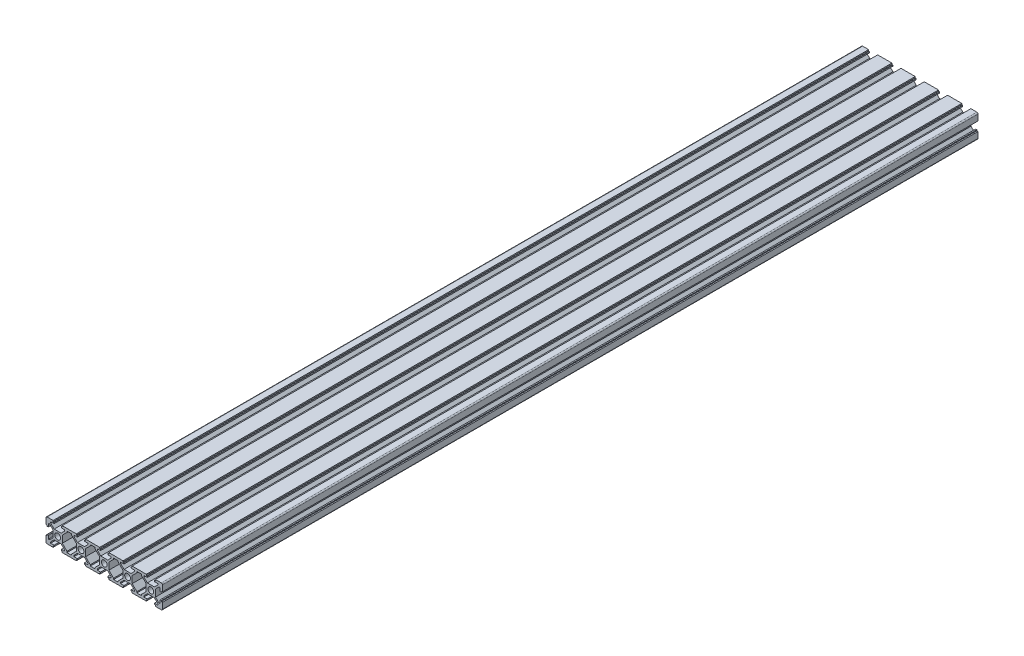
from build123d import *

# Parameters (mm, degrees)
SKETCH1_R              = 2.5
EXTRUDE1_DEPTH         = 350
FILLET_2_R             = 1
CUT_EXTRUDE1_START     = -4
CUT_EXTRUDE1_OUTLINE_R = 2
CUT_EXTRUDE1_DEPTH     = 8


# Read off the part's stored shape, not the designer's step: Cut-Extrude1
with BuildPart() as part:
    # Sketch1 → Extrude1 (new, symmetric)
    with BuildSketch(Plane.XY):
        Polygon((-20, 10), (-13.9, 10), (-13.9, 8.996845012), (-13.1, 8.996845012), (-13.1, 8), (-16.004631122, 8), (-16.004631122, 6.994580616), (-13.010050506, 4), (-6.989949494, 4), (-3.995368878, 6.994580616), (-3.995368878, 8), (-6.9, 8), (-6.9, 8.996845012), (-6.1, 8.996845012), (-6.1, 10), (6.1, 10), (6.1, 8.996845012), (6.9, 8.996845012), (6.9, 8), (3.995368878, 8), (3.995368878, 6.994580616), (6.989949494, 4), (13.010050506, 4), (16.004631122, 6.994580616), (16.004631122, 8), (13.1, 8), (13.1, 8.996845012), (13.9, 8.996845012), (13.9, 10), (26.1, 10), (26.1, 8.996845012), (26.9, 8.996845012), (26.9, 8), (23.995368878, 8), (23.995368878, 6.994580616), (26.989949494, 4), (33.010050506, 4), (36.004631122, 6.994580616), (36.004631122, 8), (33.1, 8), (33.1, 8.996845012), (33.9, 8.996845012), (33.9, 10), (46.1, 10), (46.1, 8.996845012), (46.9, 8.996845012), (46.9, 8), (43.995368878, 8), (43.995368878, 6.994580616), (46.989949494, 4), (53.010050506, 4), (56.004631122, 6.994580616), (56.004631122, 8), (53.1, 8), (53.1, 8.996845012), (53.9, 8.996845012), (53.9, 10), (66.1, 10), (66.1, 8.996845012), (66.9, 8.996845012), (66.9, 8), (63.995368878, 8), (63.995368878, 6.994580616), (66.989949494, 4), (73.010050506, 4), (76.004631122, 6.994580616), (76.004631122, 8), (73.1, 8), (73.1, 8.996845012), (73.9, 8.996845012), (73.9, 10), (80, 10), (80, 3.9), (78.996845012, 3.9), (78.996845012, 3.09747601), (78, 3.09747601), (78, 6), (76.989949494, 6), (74, 3.010050506), (74, -3.010050506), (76.989949494, -6), (78, -6), (78, -3.09747601), (78.996845012, -3.09747601), (78.996845012, -3.9), (80, -3.9), (80, -10), (73.9, -10), (73.9, -8.996845012), (73.1, -8.996845012), (73.1, -8), (76.004631122, -8), (76.004631122, -6.994580616), (73.010050506, -4), (66.989949494, -4), (63.995368878, -6.994580616), (63.995368878, -8), (66.9, -8), (66.9, -8.996845012), (66.1, -8.996845012), (66.1, -10), (53.9, -10), (53.9, -8.996845012), (53.1, -8.996845012), (53.1, -8), (56.004631122, -8), (56.004631122, -6.994580616), (53.010050506, -4), (46.989949494, -4), (43.995368878, -6.994580616), (43.995368878, -8), (46.9, -8), (46.9, -8.996845012), (46.1, -8.996845012), (46.1, -10), (33.9, -10), (33.9, -8.996845012), (33.1, -8.996845012), (33.1, -8), (36.004631122, -8), (36.004631122, -6.994580616), (33.010050506, -4), (26.989949494, -4), (23.995368878, -6.994580616), (23.995368878, -8), (26.9, -8), (26.9, -8.996845012), (26.1, -8.996845012), (26.1, -10), (13.9, -10), (13.9, -8.996845012), (13.1, -8.996845012), (13.1, -8), (16.004631122, -8), (16.004631122, -6.994580616), (13.010050506, -4), (6.989949494, -4), (3.995368878, -6.994580616), (3.995368878, -8), (6.9, -8), (6.9, -8.996845012), (6.1, -8.996845012), (6.1, -10), (-6.1, -10), (-6.1, -8.996845012), (-6.9, -8.996845012), (-6.9, -8), (-3.995368878, -8), (-3.995368878, -6.994580616), (-6.989949494, -4), (-13.010050506, -4), (-16.004631122, -6.994580616), (-16.004631122, -8), (-13.1, -8), (-13.1, -8.996845012), (-13.9, -8.996845012), (-13.9, -10), (-20, -10), (-20, -3.9), (-18.996845012, -3.9), (-18.996845012, -3.09747601), (-18, -3.09747601), (-18, -6), (-16.989949494, -6), (-14, -3.010050506), (-14, 3.010050506), (-16.989949494, 6), (-18, 6), (-18, 3.09747601), (-18.996845012, 3.09747601), (-18.996845012, 3.9), (-20, 3.9), align=None)
        with Locations((-10, 0)):
            Circle(SKETCH1_R, mode=Mode.SUBTRACT)
        with Locations((10, 0)):
            Circle(SKETCH1_R, mode=Mode.SUBTRACT)
        with Locations((30, 0)):
            Circle(SKETCH1_R, mode=Mode.SUBTRACT)
        with Locations((50, 0)):
            Circle(SKETCH1_R, mode=Mode.SUBTRACT)
        with Locations((70, 0)):
            Circle(SKETCH1_R, mode=Mode.SUBTRACT)
        Polygon((22.015469891, 8), (17.984530109, 8), (17.984530109, 6.994580616), (14, 3.010050506), (14, -3.010050506), (17.984530109, -6.994580616), (17.984530109, -8), (22.015469891, -8), (22.015469891, -6.994580616), (26, -3.010050506), (26, 3.010050506), (22.015469891, 6.994580616), align=None, mode=Mode.SUBTRACT)
        Polygon((42.015469891, 8), (37.984530109, 8), (37.984530109, 6.994580616), (34, 3.010050506), (34, -3.010050506), (37.984530109, -6.994580616), (37.984530109, -8), (42.015469891, -8), (42.015469891, -6.994580616), (46, -3.010050506), (46, 3.010050506), (42.015469891, 6.994580616), align=None, mode=Mode.SUBTRACT)
        Polygon((62.015469891, 8), (57.984530109, 8), (57.984530109, 6.994580616), (54, 3.010050506), (54, -3.010050506), (57.984530109, -6.994580616), (57.984530109, -8), (62.015469891, -8), (62.015469891, -6.994580616), (66, -3.010050506), (66, 3.010050506), (62.015469891, 6.994580616), align=None, mode=Mode.SUBTRACT)
        Polygon((2.015469891, -8), (2.015469891, -6.994580616), (6, -3.010050506), (6, 3.010050506), (2.015469891, 6.994580616), (2.015469891, 8), (-2.015469891, 8), (-2.015469891, 6.994580616), (-6, 3.010050506), (-6, -3.010050506), (-2.015469891, -6.994580616), (-2.015469891, -8), align=None, mode=Mode.SUBTRACT)
    extrude(amount=EXTRUDE1_DEPTH, both=True)

    # Fillet 2
    fillet_2_edges = [part.edges().sort_by_distance(p)[0] for p in [
        (80, 10, 0),
        (80, -10, 0),
        (-20, -10, 0),
        (-20, 10, 0),
    ]]
    fillet(fillet_2_edges, radius=FILLET_2_R)

    # Cut-Extrude1 outline → Cut-Extrude1 (cut)
    with BuildSketch(Plane(origin=(0, 0, 0), x_dir=(1, 0, 0), z_dir=(0, 1, 0)).offset(CUT_EXTRUDE1_START)):
        with Locations((70, 340)):
            Circle(CUT_EXTRUDE1_OUTLINE_R)
        with Locations((50, 340)):
            Circle(CUT_EXTRUDE1_OUTLINE_R)
        with Locations((30, 340)):
            Circle(CUT_EXTRUDE1_OUTLINE_R)
        with Locations((10, 340)):
            Circle(CUT_EXTRUDE1_OUTLINE_R)
        with Locations((-10, 340)):
            Circle(CUT_EXTRUDE1_OUTLINE_R)
    cut_extrude1 = extrude(amount=CUT_EXTRUDE1_DEPTH, mode=Mode.SUBTRACT)

    # Mirror1: Cut-Extrude1 across plane
    add(cut_extrude1.mirror(Plane.XY), mode=Mode.SUBTRACT)


solid = part.part
